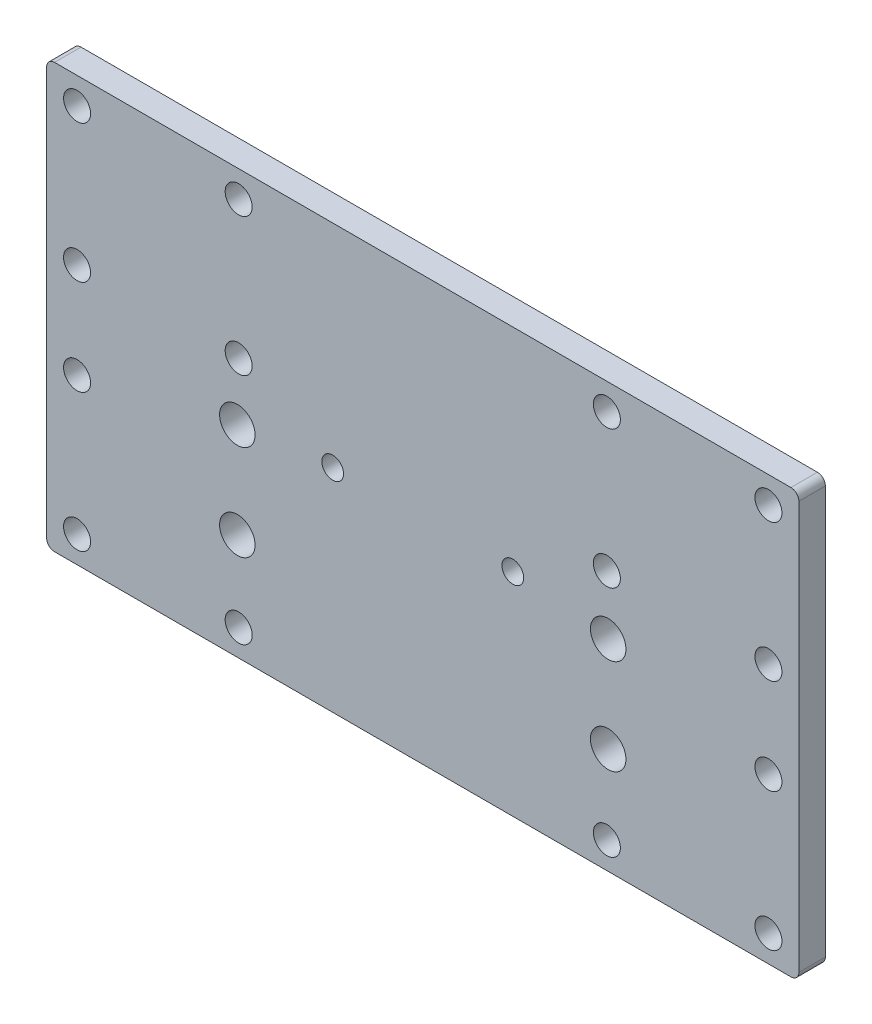
from build123d import *

# Parameters (mm, degrees)
SKETCH1_W           = 142
SKETCH1_H           = 80
BOSS_EXTRUDE1_DEPTH = 2.5
SKETCH2_R           = 2.55
CUT_EXTRUDE1_DEPTH  = 82.645575508
SKETCH3_R           = 2.05
CUT_EXTRUDE2_DEPTH  = 82.645575508
SKETCH4_R           = 3.35
CUT_EXTRUDE3_DEPTH  = 82.645575508
FILLET1_R           = 1.5


with BuildPart() as part:
    # Sketch1 → Boss-Extrude1 (new, symmetric)
    with BuildSketch(Plane.XY):
        Rectangle(SKETCH1_W, SKETCH1_H)
    extrude(amount=BOSS_EXTRUDE1_DEPTH, both=True)

    # Sketch2 → Cut-Extrude1 (cut, through all)
    with BuildSketch(Plane.XY.offset(2.5)):
        with Locations((-65.25, 35)):
            Circle(SKETCH2_R)
        with Locations((-34.75, 35)):
            Circle(SKETCH2_R)
        with Locations((-34.75, 9)):
            Circle(SKETCH2_R)
        with Locations((-65.25, 9)):
            Circle(SKETCH2_R)
        with Locations((65.25, 35)):
            Circle(SKETCH2_R)
        with Locations((65.25, 9)):
            Circle(SKETCH2_R)
        with Locations((34.75, 9)):
            Circle(SKETCH2_R)
        with Locations((34.75, 35)):
            Circle(SKETCH2_R)
        with Locations((-65.25, -9)):
            Circle(SKETCH2_R)
        with Locations((-34.75, -35)):
            Circle(SKETCH2_R)
        with Locations((-65.25, -35)):
            Circle(SKETCH2_R)
        with Locations((65.25, -9)):
            Circle(SKETCH2_R)
        with Locations((65.25, -35)):
            Circle(SKETCH2_R)
        with Locations((34.75, -35)):
            Circle(SKETCH2_R)
    extrude(amount=-CUT_EXTRUDE1_DEPTH, mode=Mode.SUBTRACT)

    # Sketch3 → Cut-Extrude2 (cut, through all)
    with BuildSketch(Plane.XY.offset(2.5)):
        with Locations((-17, 0)):
            Circle(SKETCH3_R)
        with Locations((17, 0)):
            Circle(SKETCH3_R)
    extrude(amount=-CUT_EXTRUDE2_DEPTH, mode=Mode.SUBTRACT)

    # Sketch4 → Cut-Extrude3 (cut, through all)
    with BuildSketch(Plane.XY.offset(2.5)):
        with Locations((-35, -2)):
            Circle(SKETCH4_R)
        with Locations((35, -2)):
            Circle(SKETCH4_R)
        with Locations((35, -20)):
            Circle(SKETCH4_R)
        with Locations((-35, -20)):
            Circle(SKETCH4_R)
    extrude(amount=-CUT_EXTRUDE3_DEPTH, mode=Mode.SUBTRACT)

    # Fillet1
    fillet1_edges = [part.edges().sort_by_distance(p)[0] for p in [
        (-71, -40, 0),
        (71, -40, 0),
        (71, 40, 0),
        (-71, 40, 0),
    ]]
    fillet(fillet1_edges, radius=FILLET1_R)


solid = part.part
